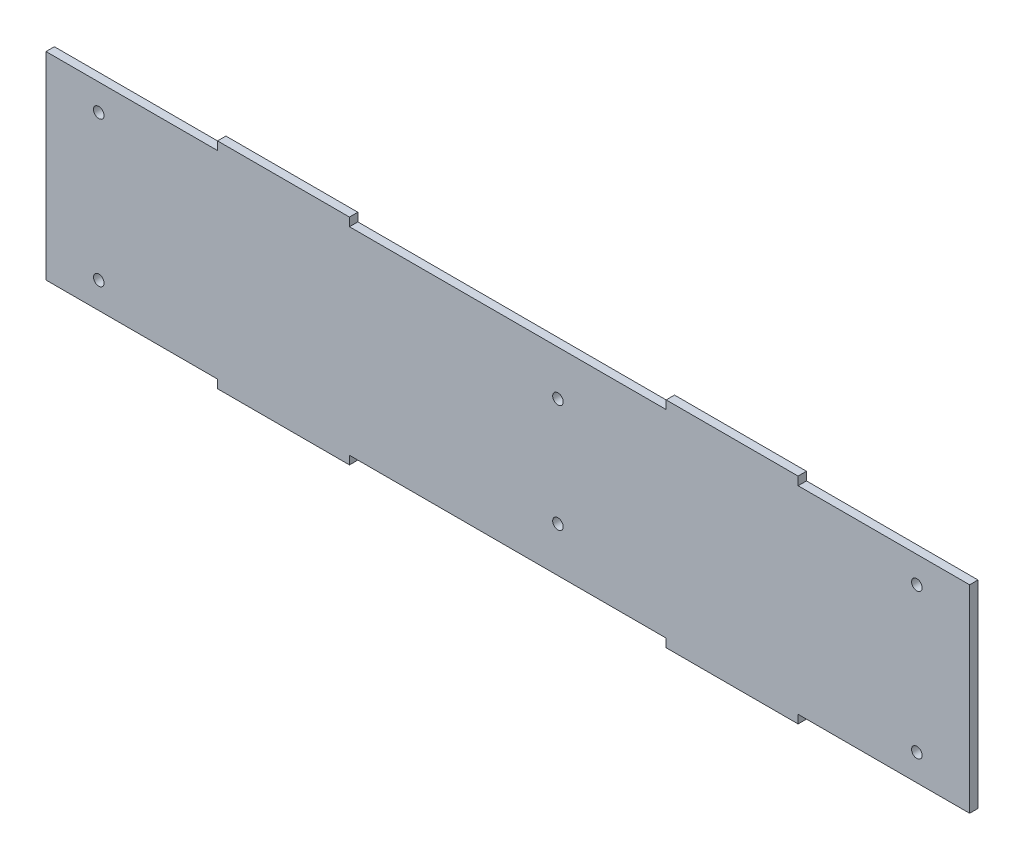
from build123d import *

# Parameters (mm, degrees)
SKETCH2_R           = 2
BOSS_EXTRUDE1_DEPTH = 3.175


with BuildPart() as part:
    # Sketch2 → Boss-Extrude1 (new body)
    with BuildSketch(Plane.XY):
        Polygon((0, 0), (65, 0), (65, -3.175), (115, -3.175), (115, 0), (235, 0), (235, -3.175), (285, -3.175), (285, 0), (350, 0), (350, 75), (285, 75), (285, 78.175), (235, 78.175), (235, 75), (115, 75), (115, 78.175), (65, 78.175), (65, 75), (0, 75), align=None)
        with Locations((20, 10)):
            Circle(SKETCH2_R, mode=Mode.SUBTRACT)
        with Locations((330, 10)):
            Circle(SKETCH2_R, mode=Mode.SUBTRACT)
        with Locations((330, 65)):
            Circle(SKETCH2_R, mode=Mode.SUBTRACT)
        with Locations((20, 65)):
            Circle(SKETCH2_R, mode=Mode.SUBTRACT)
        with Locations((194, 17)):
            Circle(SKETCH2_R, mode=Mode.SUBTRACT)
        with Locations((194, 58)):
            Circle(SKETCH2_R, mode=Mode.SUBTRACT)
    extrude(amount=BOSS_EXTRUDE1_DEPTH)


solid = part.part
